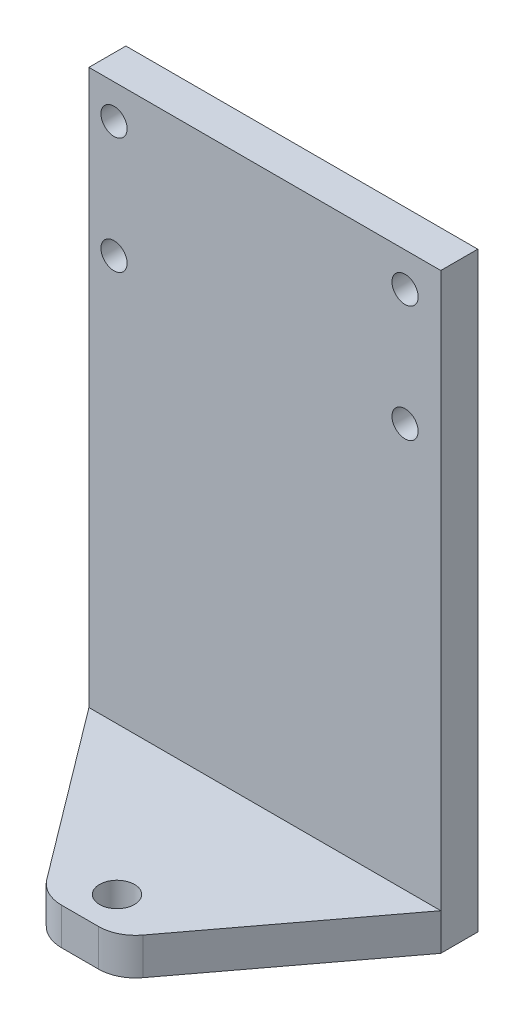
from build123d import *

# Parameters (mm, degrees)
SKETCH1_W           = 60.452
SKETCH1_H           = 101.6
BOSS_EXTRUDE1_DEPTH = 3.175
SKETCH2_W           = 60.452
SKETCH2_H           = 57.15
BOSS_EXTRUDE2_DEPTH = 6.35
SKETCH3_R           = 2.25
CUT_EXTRUDE1_DEPTH  = 83.221490962
SKETCH4_R           = 3
CUT_EXTRUDE2_DEPTH  = 114.575852191
CUT_EXTRUDE3_DEPTH  = 114.575852191
FILLET1_R           = 6.35


with BuildPart() as part:
    # Sketch1 → Boss-Extrude1 (new, symmetric)
    with BuildSketch(Plane.XY):
        Rectangle(SKETCH1_W, SKETCH1_H)
    extrude(amount=BOSS_EXTRUDE1_DEPTH, both=True)

    # Sketch2 → Boss-Extrude2 (add)
    with BuildSketch(Plane.XZ.offset(50.8)):
        with Locations((0, 25.4)):
            Rectangle(SKETCH2_W, SKETCH2_H)
    extrude(amount=-BOSS_EXTRUDE2_DEPTH)

    # Sketch3 → Cut-Extrude1 (cut, through all)
    with BuildSketch(Plane(origin=(0, 0, -3.175), x_dir=(-1, 0, 0), z_dir=(0, 0, -1))):
        with Locations((-24.086414833, 44.925)):
            Circle(SKETCH3_R)
        with Locations((-24.086414833, 24.925)):
            Circle(SKETCH3_R)
        with Locations((25.913585167, 24.925)):
            Circle(SKETCH3_R)
        with Locations((25.913585167, 44.925)):
            Circle(SKETCH3_R)
    extrude(amount=-CUT_EXTRUDE1_DEPTH, mode=Mode.SUBTRACT)

    # Sketch4 → Cut-Extrude2 (cut, through all)
    with BuildSketch(Plane(origin=(0, -44.45, 0), x_dir=(1, 0, 0), z_dir=(0, 1, 0))):
        with Locations((0, -28.575)):
            Circle(SKETCH4_R)
    extrude(amount=-CUT_EXTRUDE2_DEPTH, mode=Mode.SUBTRACT)

    # Sketch5 → Cut-Extrude3 (cut, through all)
    with BuildSketch(Plane(origin=(0, -44.45, 0), x_dir=(1, 0, 0), z_dir=(0, 1, 0))):
        Polygon((-30.226, -3.175), (-6.35, -34.925), (6.35, -34.925), (30.226, -3.175), (30.226, -53.975), (-30.226, -53.975), align=None)
    extrude(amount=-CUT_EXTRUDE3_DEPTH, mode=Mode.SUBTRACT)

    # Fillet1
    fillet1_edges = [part.edges().sort_by_distance(p)[0] for p in [
        (6.35, -47.625, 34.925),
        (-6.35, -47.625, 34.925),
    ]]
    fillet(fillet1_edges, radius=FILLET1_R)


solid = part.part
